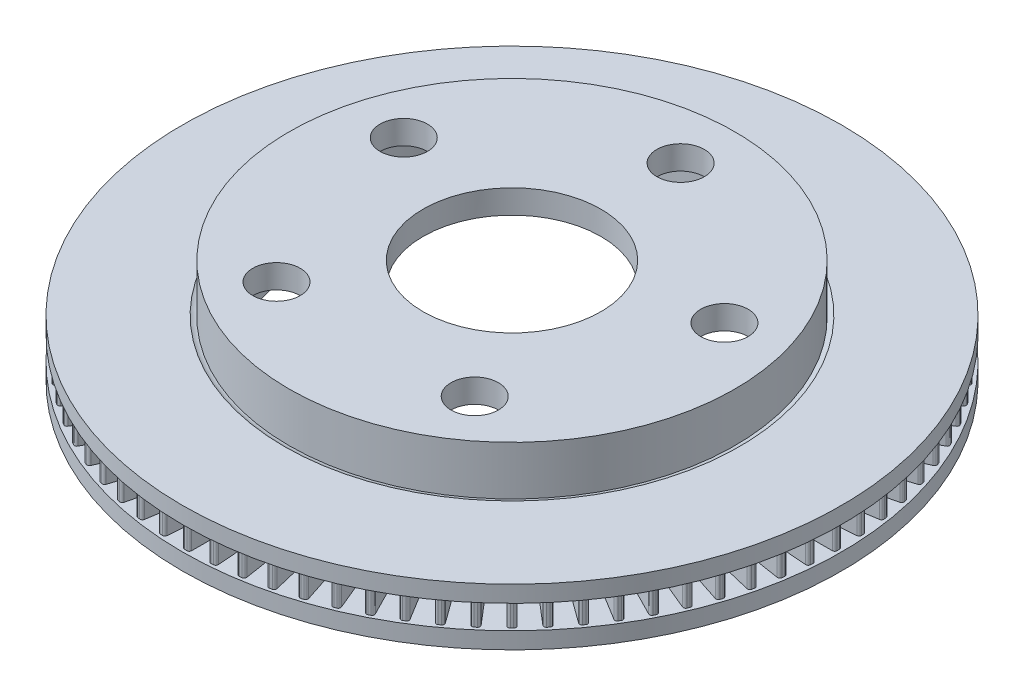
from build123d import *

# Parameters (mm, degrees)
SKETCH1_R           = 139
BOSS_EXTRUDE1_DEPTH = 7
CUT_EXTRUDE1_REACH  = 198.7
SKETCH2_R           = 86
BOSS_EXTRUDE2_DEPTH = 10
CIRPATTERN1_COUNT   = 80
SKETCH5_R           = 139
BOSS_EXTRUDE3_DEPTH = 7
CUT_EXTRUDE2_REACH  = 200.035
SKETCH6_R           = 86
SKETCH7_R           = 94
BOSS_EXTRUDE4_DEPTH = 20
CUT_EXTRUDE3_START  = -10
SKETCH8_R           = 86
CUT_EXTRUDE3_DEPTH  = 10
CUT_EXTRUDE4_REACH  = 203.44
SKETCH9_R           = 37.5
CUT_EXTRUDE7_REACH  = 203.44
SKETCH11_R          = 10
CIRPATTERN3_COUNT   = 5


with BuildPart() as part:
    # Sketch1 → Boss-Extrude1 (new body)
    with BuildSketch(Plane(origin=(0, 0, 0), x_dir=(1, 0, 0), z_dir=(0, 1, 0))):
        with Locations(Location((0, 0, 0), (0, 0, 270))):
            Circle(SKETCH1_R)
    extrude(amount=BOSS_EXTRUDE1_DEPTH)

    # Sketch2 → Cut-Extrude1 (cut, up to next)
    with BuildSketch(Plane(origin=(0, 7, 0), x_dir=(1, 0, 0), z_dir=(0, 1, 0)), mode=Mode.PRIVATE) as cut_extrude1_sk1:
        with Locations(Location((0, 0, 0), (0, 0, 270))):
            Circle(SKETCH2_R)
    cut_extrude1_tool1 = extrude(cut_extrude1_sk1.sketch, amount=-CUT_EXTRUDE1_REACH, mode=Mode.PRIVATE) & part.part
    add(cut_extrude1_tool1.solids().sort_by_distance((0, 7, 0))[0], mode=Mode.SUBTRACT)

    # Sketch3 → Boss-Extrude2 (add)
    with BuildSketch(Plane(origin=(0, 7, 0), x_dir=(1, 0, 0), z_dir=(0, 1, 0))):
        with BuildLine():
            Line((-87.59645929, 1.5), (-136.59645929, 1.5))
            ThreePointArc((-136.59645929, 1.5), (-137.303566071, 1.207106781), (-137.59645929, 0.5))
            Line((-137.59645929, 0.5), (-137.59645929, -0.5))
            ThreePointArc((-137.59645929, -0.5), (-137.303566071, -1.207106781), (-136.59645929, -1.5))
            Line((-136.59645929, -1.5), (-87.59645929, -1.5))
            ThreePointArc((-87.59645929, -1.5), (-86.889352509, -1.207106781), (-86.59645929, -0.5))
            Line((-86.59645929, -0.5), (-86.59645929, 0.5))
            ThreePointArc((-86.59645929, 0.5), (-86.889352509, 1.207106781), (-87.59645929, 1.5))
        make_face()
    boss_extrude2 = extrude(amount=BOSS_EXTRUDE2_DEPTH)

    # CirPattern1: Boss-Extrude2 ×80 about axis
    cirpattern1_axis = Axis((0, 0, 0), (0, 1, 0))
    for i in range(1, CIRPATTERN1_COUNT):
        add(boss_extrude2.rotate(cirpattern1_axis, i * 360 / CIRPATTERN1_COUNT))

    # Sketch5 → Boss-Extrude3 (add)
    with BuildSketch(Plane(origin=(0, 17, 0), x_dir=(1, 0, 0), z_dir=(0, 1, 0))):
        with Locations(Location((0, 0, 0), (0, 0, 270))):
            Circle(SKETCH5_R)
    extrude(amount=BOSS_EXTRUDE3_DEPTH)

    # Sketch6 → Cut-Extrude2 (cut, up to next)
    with BuildSketch(Plane(origin=(0, 24, 0), x_dir=(1, 0, 0), z_dir=(0, 1, 0)), mode=Mode.PRIVATE) as cut_extrude2_sk1:
        with Locations(Location((0, 0, 0), (0, 0, 270))):
            Circle(SKETCH6_R)
    cut_extrude2_tool1 = extrude(cut_extrude2_sk1.sketch, amount=-CUT_EXTRUDE2_REACH, mode=Mode.PRIVATE) & part.part
    add(cut_extrude2_tool1.solids().sort_by_distance((0, 24, 0))[0], mode=Mode.SUBTRACT)

    # Sketch7 → Boss-Extrude4 (add)
    with BuildSketch(Plane(origin=(0, 24, 0), x_dir=(1, 0, 0), z_dir=(0, 1, 0))):
        with Locations(Location((0, 0, 0), (0, 0, 270))):
            Circle(SKETCH7_R)
    extrude(amount=BOSS_EXTRUDE4_DEPTH)

    # Sketch8 → Cut-Extrude3 (cut)
    with BuildSketch(Plane.XZ.offset(-24).offset(CUT_EXTRUDE3_START)):
        with Locations(Location((0, 0, 0), (0, 0, 90))):
            Circle(SKETCH8_R)
    extrude(amount=CUT_EXTRUDE3_DEPTH, mode=Mode.SUBTRACT)

    # Sketch9 → Cut-Extrude4 (cut, up to next)
    with BuildSketch(Plane(origin=(0, 44, 0), x_dir=(1, 0, 0), z_dir=(0, 1, 0)), mode=Mode.PRIVATE) as cut_extrude4_sk1:
        with Locations(Location((0, 0, 0), (0, 0, 270))):
            Circle(SKETCH9_R)
    cut_extrude4_tool1 = extrude(cut_extrude4_sk1.sketch, amount=-CUT_EXTRUDE4_REACH, mode=Mode.PRIVATE) & part.part
    add(cut_extrude4_tool1.solids().sort_by_distance((0, 44, 0))[0], mode=Mode.SUBTRACT)

    # Sketch11 → Cut-Extrude7 (cut, up to next)
    with BuildSketch(Plane(origin=(0, 44, 0), x_dir=(1, 0, 0), z_dir=(0, 1, 0)), mode=Mode.PRIVATE) as cut_extrude7_sk1:
        with Locations(Location((0, 71.109728429, 0), (0, 0, 270))):
            Circle(SKETCH11_R)
    cut_extrude7_tool1 = extrude(cut_extrude7_sk1.sketch, amount=-CUT_EXTRUDE7_REACH, mode=Mode.PRIVATE) & part.part
    cut_extrude7 = cut_extrude7_tool1.solids().sort_by_distance((0, 44, -71.109728))[0]
    add(cut_extrude7, mode=Mode.SUBTRACT)

    # CirPattern3: Cut-Extrude7 ×5 about axis
    cirpattern3_axis = Axis((0, 0, 0), (0, 1, 0))
    for i in range(1, CIRPATTERN3_COUNT):
        add(cut_extrude7.rotate(cirpattern3_axis, i * 360 / CIRPATTERN3_COUNT), mode=Mode.SUBTRACT)

    # Sketch12 → Cut-Revolve1 (revolve, cut)
    with BuildSketch(Plane(origin=(0, 0, 0), x_dir=(0, 0, -1), z_dir=(1, 0, 0)), mode=Mode.PRIVATE) as cut_revolve1_sk:
        with BuildLine():
            Line((94, 24.123462264), (94, 23.303534267))
            ThreePointArc((94, 23.303534267), (95.144677203, 23.583435926), (96.192056023, 24.123462264))
            Line((96.192056023, 24.123462264), (94, 24.123462264))
        make_face()
    revolve(cut_revolve1_sk.sketch.rotate(Axis((0, 106.26697353, 0), (0, -1, 0)), 180), axis=Axis((0, 106.26697353, 0), (0, -1, 0)), mode=Mode.SUBTRACT)


solid = part.part
